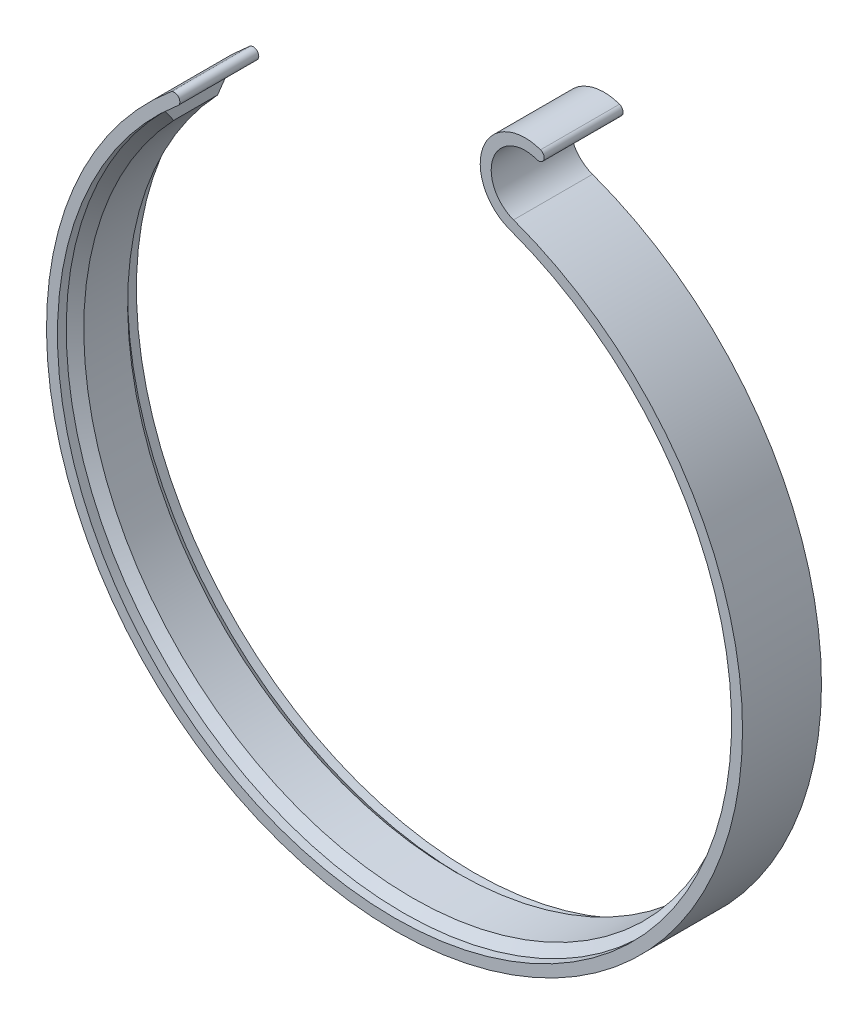
from build123d import *

# Parameters (mm, degrees)
BOSS_EXTRUDE1_DEPTH      = 18
REVOLVE1_ANGLE           = 155
REVOLVE1_OTHER_WAY_ANGLE = 135
CHAMFER1_SIZE            = 2


with BuildPart() as part:
    # Sketch1 → Boss-Extrude1 (new body)
    with BuildSketch(Plane.XY):
        with BuildLine():
            ThreePointArc((26.284248015, 72.215377907), (13.344862454, -75.682475819), (-49.398227804, 58.870515454))
            ThreePointArc((-49.398227804, 58.870515454), (-48.984779038, 59.542460442), (-49.056117508, 60.328183531))
            ThreePointArc((-49.056117508, 60.328183531), (-49.916101751, 61.045004286), (-51.005196829, 60.785626561))
            ThreePointArc((-51.005196829, 60.785626561), (13.778982898, -78.144495202), (27.139298373, 74.564609459))
            ThreePointArc((27.139298373, 74.564609459), (22.507336673, 84.497883381), (32.440610594, 89.129845082))
            ThreePointArc((32.440610594, 89.129845082), (32.488426827, 89.113527981), (32.536863386, 89.099156495))
            ThreePointArc((32.536863386, 89.099156495), (34.05906865, 89.924751911), (33.295660953, 91.479076634))
            ThreePointArc((33.295660953, 91.479076634), (20.158105121, 85.35293374), (26.284248015, 72.215377907))
        make_face()
    extrude(amount=BOSS_EXTRUDE1_DEPTH)

    # Sketch2 → Revolve1 (revolve)
    with BuildSketch(Plane(origin=(0, 0, 0), x_dir=(0, 0, -1), z_dir=(1, 0, 0))):
        Polygon((-14, -74.85), (-16, -76.85), (-2, -76.85), (-4, -74.85), align=None)
    revolve(axis=Axis((0, 0, 0), (0, 0, 1)), revolution_arc=REVOLVE1_ANGLE)

    # Sketch2 → Revolve1 other way (revolve)
    with BuildSketch(Plane(origin=(0, 0, 0), x_dir=(0, 0, -1), z_dir=(1, 0, 0))):
        Polygon((-14, -74.85), (-16, -76.85), (-2, -76.85), (-4, -74.85), align=None)
    revolve(axis=Axis((0, 0, 0), (0, 0, -1)), revolution_arc=REVOLVE1_OTHER_WAY_ANGLE)

    # Chamfer1
    # the kernel refuses this chamfer: 2 mm, written as the material it takes off along each edge
    with BuildSketch(Plane(origin=(31.632976891, 67.83713786, -1.214315162), x_dir=(0.9005003860175051, -0.4348552112856927, 0), z_dir=(0, 0, 1))) as chamfer1_piece_1_section:
        with BuildLine():
            Line((2.027650031, 0), (-CHAMFER1_SIZE * 0.0135447563861, CHAMFER1_SIZE * 0.99990826558))
            Line((-CHAMFER1_SIZE * 0.0135447563861, CHAMFER1_SIZE * 0.99990826558), (0, 0))
            ThreePointArc((0, 0), (1.042503113, 0.006860827), (2.027650031, 0))
        make_face()
    chamfer1_piece_1 = extrude(amount=20.428630325, mode=Mode.PRIVATE)
    chamfer1_piece_1 = chamfer1_piece_1 & Plane(origin=(0, 0, -1.214315162), x_dir=(0.3420201433256637, 0.9396926207859103, 0), z_dir=(0, 0, -1)) * Cylinder(76.85, 49, mode=Mode.PRIVATE)
    add(chamfer1_piece_1, mode=Mode.SUBTRACT)
    with BuildSketch(Plane(origin=(-52.926942572, 52.926942572, -1.214315162), x_dir=(-0.6974643260656699, -0.7166195042459848, 0), z_dir=(0, 0, 1))) as chamfer1_piece_2_section:
        with BuildLine():
            Line((2.027650031, 0), (-CHAMFER1_SIZE * 0.0135447563861, -CHAMFER1_SIZE * 0.99990826558))
            Line((-CHAMFER1_SIZE * 0.0135447563861, -CHAMFER1_SIZE * 0.99990826558), (0, 0))
            ThreePointArc((0, 0), (1.042503113, -0.006860827), (2.027650031, 0))
        make_face()
    chamfer1_piece_2 = extrude(amount=20.428630325, mode=Mode.PRIVATE)
    chamfer1_piece_2 = chamfer1_piece_2 & Plane(origin=(0, 0, -1.214315162), x_dir=(0.3420201433256637, 0.9396926207859103, 0), z_dir=(0, 0, -1)) * Cylinder(76.85, 49, mode=Mode.PRIVATE)
    add(chamfer1_piece_2, mode=Mode.SUBTRACT)


solid = part.part
